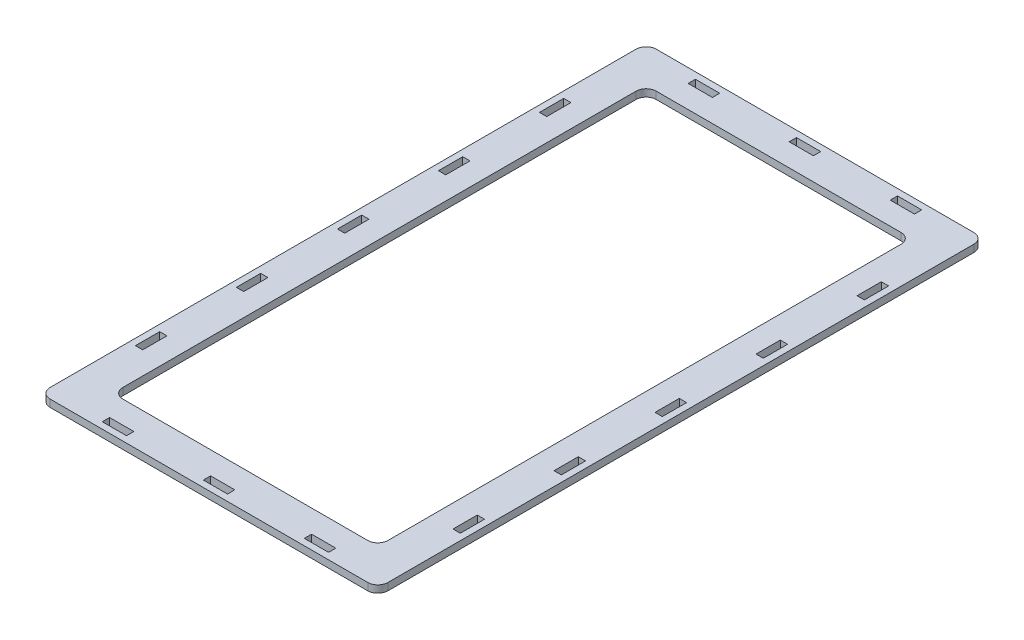
from build123d import *

# Parameters (mm, degrees)
SKETCH_1_W               = 836
SKETCH_1_H               = 1500
SKETCH_1_W_2             = 656
SKETCH_1_H_2             = 1320
EXTRUDE_1_DEPTH          = 18
SKETCH_1_5_W             = 18
SKETCH_1_5_H             = 60
CUT_EXTRUDE_1_DEPTH      = 859.806148092
PATTERN_LINEAR_1_COUNT   = 5
PATTERN_LINEAR_1_PITCH   = 250
MIRROR_1_COPY_1_SKETCH_W = 18
MIRROR_1_COPY_1_SKETCH_H = 60
MIRROR_1_COPY_1_DEPTH    = 859.806148092
MIRROR_1_COPY_2_SKETCH_W = 18
MIRROR_1_COPY_2_SKETCH_H = 60
MIRROR_1_COPY_2_DEPTH    = 859.806148092
MIRROR_1_COPY_3_SKETCH_W = 18
MIRROR_1_COPY_3_SKETCH_H = 60
MIRROR_1_COPY_3_DEPTH    = 859.806148092
MIRROR_1_COPY_4_SKETCH_W = 18
MIRROR_1_COPY_4_SKETCH_H = 60
MIRROR_1_COPY_4_DEPTH    = 859.806148092
SKETCH_1_4_W             = 60
SKETCH_1_4_H             = 18
CUT_EXTRUDE_2_DEPTH      = 859.806148092
PATTERN_LINEAR_2_COUNT   = 3
PATTERN_LINEAR_2_PITCH   = 250
MIRROR_2_COPY_1_SKETCH_W = 60
MIRROR_2_COPY_1_SKETCH_H = 18
MIRROR_2_COPY_1_DEPTH    = 859.806148092
MIRROR_2_COPY_2_SKETCH_W = 60
MIRROR_2_COPY_2_SKETCH_H = 18
MIRROR_2_COPY_2_DEPTH    = 859.806148092
FILLET_1_R               = 25
FILLET_2_R               = 25


with BuildPart() as part:
    # 草图1 → 凸台-拉伸1 (new body)
    with BuildSketch(Plane(origin=(0, 0, 0), x_dir=(1, 0, 0), z_dir=(0, 1, 0))):
        Rectangle(SKETCH_1_W, SKETCH_1_H)
        Rectangle(SKETCH_1_W_2, SKETCH_1_H_2, mode=Mode.SUBTRACT)
    extrude(amount=EXTRUDE_1_DEPTH)

    # 草图1<5> → 切除-拉伸1 (cut, through all)
    with BuildSketch(Plane(origin=(0, 0, 0), x_dir=(1, 0, 0), z_dir=(0, 1, 0))):
        with Locations((-393, -500)):
            Rectangle(SKETCH_1_5_W, SKETCH_1_5_H)
    cut_extrude_1 = extrude(amount=CUT_EXTRUDE_1_DEPTH, mode=Mode.SUBTRACT)

    # 阵列(线性)1: 切除-拉伸1 ×5
    with Locations(*[(0, 0, -i * PATTERN_LINEAR_1_PITCH) for i in range(1, PATTERN_LINEAR_1_COUNT)]):
        add(cut_extrude_1, mode=Mode.SUBTRACT)

    # 镜向1: 切除-拉伸1 across plane
    add(cut_extrude_1.mirror(Plane(origin=(0, 0, 0), x_dir=(0, 0, 1), z_dir=(1, 0, 0))), mode=Mode.SUBTRACT)

    # 镜向1 copy 1 sketch → 镜向1 copy 1 (cut, through all)
    with BuildSketch(Plane(origin=(0, 0, -250), x_dir=(-1, 0, 0), z_dir=(0, 1, 0))):
        with Locations((-393, 500)):
            Rectangle(MIRROR_1_COPY_1_SKETCH_W, MIRROR_1_COPY_1_SKETCH_H)
    extrude(amount=MIRROR_1_COPY_1_DEPTH, mode=Mode.SUBTRACT)

    # 镜向1 copy 2 sketch → 镜向1 copy 2 (cut, through all)
    with BuildSketch(Plane(origin=(0, 0, -500), x_dir=(-1, 0, 0), z_dir=(0, 1, 0))):
        with Locations((-393, 500)):
            Rectangle(MIRROR_1_COPY_2_SKETCH_W, MIRROR_1_COPY_2_SKETCH_H)
    extrude(amount=MIRROR_1_COPY_2_DEPTH, mode=Mode.SUBTRACT)

    # 镜向1 copy 3 sketch → 镜向1 copy 3 (cut, through all)
    with BuildSketch(Plane(origin=(0, 0, -750), x_dir=(-1, 0, 0), z_dir=(0, 1, 0))):
        with Locations((-393, 500)):
            Rectangle(MIRROR_1_COPY_3_SKETCH_W, MIRROR_1_COPY_3_SKETCH_H)
    extrude(amount=MIRROR_1_COPY_3_DEPTH, mode=Mode.SUBTRACT)

    # 镜向1 copy 4 sketch → 镜向1 copy 4 (cut, through all)
    with BuildSketch(Plane(origin=(0, 0, -1000), x_dir=(-1, 0, 0), z_dir=(0, 1, 0))):
        with Locations((-393, 500)):
            Rectangle(MIRROR_1_COPY_4_SKETCH_W, MIRROR_1_COPY_4_SKETCH_H)
    extrude(amount=MIRROR_1_COPY_4_DEPTH, mode=Mode.SUBTRACT)

    # 草图1<4> → 切除-拉伸2 (cut, through all)
    with BuildSketch(Plane(origin=(0, 0, 0), x_dir=(1, 0, 0), z_dir=(0, 1, 0))):
        with Locations((-250, -725)):
            Rectangle(SKETCH_1_4_W, SKETCH_1_4_H)
    cut_extrude_2 = extrude(amount=CUT_EXTRUDE_2_DEPTH, mode=Mode.SUBTRACT)

    # 阵列(线性)2: 切除-拉伸2 ×3
    with Locations(*[(i * PATTERN_LINEAR_2_PITCH, 0, 0) for i in range(1, PATTERN_LINEAR_2_COUNT)]):
        add(cut_extrude_2, mode=Mode.SUBTRACT)

    # 镜向2: 切除-拉伸2 across plane
    add(cut_extrude_2.mirror(Plane.XY), mode=Mode.SUBTRACT)

    # 镜向2 copy 1 sketch → 镜向2 copy 1 (cut, through all)
    with BuildSketch(Plane(origin=(250, 0, 0), x_dir=(1, 0, 0), z_dir=(0, 1, 0))):
        with Locations((-250, 725)):
            Rectangle(MIRROR_2_COPY_1_SKETCH_W, MIRROR_2_COPY_1_SKETCH_H)
    extrude(amount=MIRROR_2_COPY_1_DEPTH, mode=Mode.SUBTRACT)

    # 镜向2 copy 2 sketch → 镜向2 copy 2 (cut, through all)
    with BuildSketch(Plane(origin=(500, 0, 0), x_dir=(1, 0, 0), z_dir=(0, 1, 0))):
        with Locations((-250, 725)):
            Rectangle(MIRROR_2_COPY_2_SKETCH_W, MIRROR_2_COPY_2_SKETCH_H)
    extrude(amount=MIRROR_2_COPY_2_DEPTH, mode=Mode.SUBTRACT)

    # 圆角1
    fillet_1_edges = [part.edges().sort_by_distance(p)[0] for p in [
        (-418, 9, -750),
        (418, 9, -750),
        (418, 9, 750),
        (-418, 9, 750),
    ]]
    fillet(fillet_1_edges, radius=FILLET_1_R)

    # 圆角2
    fillet_2_edges = [part.edges().sort_by_distance(p)[0] for p in [
        (-328, 9, -660),
        (328, 9, -660),
        (328, 9, 660),
        (-328, 9, 660),
    ]]
    fillet(fillet_2_edges, radius=FILLET_2_R)


solid = part.part
